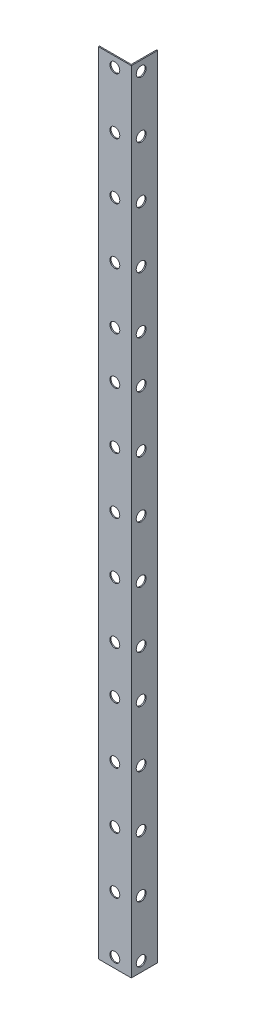
from build123d import *

# Parameters (mm, degrees)
BOSS_EXTRUDE1_DEPTH = 360
CUT_EXTRUDE1_REACH  = 362.492
SKETCH2_R           = 2.25
CUT_EXTRUDE2_REACH  = 362.512
SKETCH3_R           = 2.25


with BuildPart() as part:
    # Sketch1 → Boss-Extrude1 (new body)
    with BuildSketch(Plane(origin=(0, 0, 0), x_dir=(1, 0, 0), z_dir=(0, 1, 0))):
        Polygon((0, 0), (15, 0), (15, 12), (14.5, 12), (14.5, 0.5), (0, 0.5), align=None)
    extrude(amount=BOSS_EXTRUDE1_DEPTH)

    # Sketch2 → Cut-Extrude1 (cut, up to next)
    with BuildSketch(Plane.ZY.offset(-14.5), mode=Mode.PRIVATE) as cut_extrude1_sk1:
        with Locations((-4.5, 355.5)):
            Circle(SKETCH2_R)
    cut_extrude1_tool1 = extrude(cut_extrude1_sk1.sketch, amount=-CUT_EXTRUDE1_REACH, mode=Mode.PRIVATE) & part.part
    # Sketch2 → Cut-Extrude1 (cut, up to next)
    with BuildSketch(Plane.ZY.offset(-14.5), mode=Mode.PRIVATE) as cut_extrude1_sk2:
        with Locations((-4.5, 329.8125)):
            Circle(SKETCH2_R)
    cut_extrude1_tool2 = extrude(cut_extrude1_sk2.sketch, amount=-CUT_EXTRUDE1_REACH, mode=Mode.PRIVATE) & part.part
    # Sketch2 → Cut-Extrude1 (cut, up to next)
    with BuildSketch(Plane.ZY.offset(-14.5), mode=Mode.PRIVATE) as cut_extrude1_sk3:
        with Locations((-4.5, 304.125)):
            Circle(SKETCH2_R)
    cut_extrude1_tool3 = extrude(cut_extrude1_sk3.sketch, amount=-CUT_EXTRUDE1_REACH, mode=Mode.PRIVATE) & part.part
    # Sketch2 → Cut-Extrude1 (cut, up to next)
    with BuildSketch(Plane.ZY.offset(-14.5), mode=Mode.PRIVATE) as cut_extrude1_sk4:
        with Locations((-4.5, 278.4375)):
            Circle(SKETCH2_R)
    cut_extrude1_tool4 = extrude(cut_extrude1_sk4.sketch, amount=-CUT_EXTRUDE1_REACH, mode=Mode.PRIVATE) & part.part
    # Sketch2 → Cut-Extrude1 (cut, up to next)
    with BuildSketch(Plane.ZY.offset(-14.5), mode=Mode.PRIVATE) as cut_extrude1_sk5:
        with Locations((-4.5, 252.75)):
            Circle(SKETCH2_R)
    cut_extrude1_tool5 = extrude(cut_extrude1_sk5.sketch, amount=-CUT_EXTRUDE1_REACH, mode=Mode.PRIVATE) & part.part
    # Sketch2 → Cut-Extrude1 (cut, up to next)
    with BuildSketch(Plane.ZY.offset(-14.5), mode=Mode.PRIVATE) as cut_extrude1_sk6:
        with Locations((-4.5, 231.375)):
            Circle(SKETCH2_R)
    cut_extrude1_tool6 = extrude(cut_extrude1_sk6.sketch, amount=-CUT_EXTRUDE1_REACH, mode=Mode.PRIVATE) & part.part
    # Sketch2 → Cut-Extrude1 (cut, up to next)
    with BuildSketch(Plane.ZY.offset(-14.5), mode=Mode.PRIVATE) as cut_extrude1_sk7:
        with Locations((-4.5, 205.6875)):
            Circle(SKETCH2_R)
    cut_extrude1_tool7 = extrude(cut_extrude1_sk7.sketch, amount=-CUT_EXTRUDE1_REACH, mode=Mode.PRIVATE) & part.part
    # Sketch2 → Cut-Extrude1 (cut, up to next)
    with BuildSketch(Plane.ZY.offset(-14.5), mode=Mode.PRIVATE) as cut_extrude1_sk8:
        with Locations((-4.5, 180)):
            Circle(SKETCH2_R)
    cut_extrude1_tool8 = extrude(cut_extrude1_sk8.sketch, amount=-CUT_EXTRUDE1_REACH, mode=Mode.PRIVATE) & part.part
    # Sketch2 → Cut-Extrude1 (cut, up to next)
    with BuildSketch(Plane.ZY.offset(-14.5), mode=Mode.PRIVATE) as cut_extrude1_sk9:
        with Locations((-4.5, 154.3125)):
            Circle(SKETCH2_R)
    cut_extrude1_tool9 = extrude(cut_extrude1_sk9.sketch, amount=-CUT_EXTRUDE1_REACH, mode=Mode.PRIVATE) & part.part
    # Sketch2 → Cut-Extrude1 (cut, up to next)
    with BuildSketch(Plane.ZY.offset(-14.5), mode=Mode.PRIVATE) as cut_extrude1_sk10:
        with Locations((-4.5, 128.625)):
            Circle(SKETCH2_R)
    cut_extrude1_tool10 = extrude(cut_extrude1_sk10.sketch, amount=-CUT_EXTRUDE1_REACH, mode=Mode.PRIVATE) & part.part
    # Sketch2 → Cut-Extrude1 (cut, up to next)
    with BuildSketch(Plane.ZY.offset(-14.5), mode=Mode.PRIVATE) as cut_extrude1_sk11:
        with Locations((-4.5, 107.25)):
            Circle(SKETCH2_R)
    cut_extrude1_tool11 = extrude(cut_extrude1_sk11.sketch, amount=-CUT_EXTRUDE1_REACH, mode=Mode.PRIVATE) & part.part
    # Sketch2 → Cut-Extrude1 (cut, up to next)
    with BuildSketch(Plane.ZY.offset(-14.5), mode=Mode.PRIVATE) as cut_extrude1_sk12:
        with Locations((-4.5, 81.5625)):
            Circle(SKETCH2_R)
    cut_extrude1_tool12 = extrude(cut_extrude1_sk12.sketch, amount=-CUT_EXTRUDE1_REACH, mode=Mode.PRIVATE) & part.part
    # Sketch2 → Cut-Extrude1 (cut, up to next)
    with BuildSketch(Plane.ZY.offset(-14.5), mode=Mode.PRIVATE) as cut_extrude1_sk13:
        with Locations((-4.5, 55.875)):
            Circle(SKETCH2_R)
    cut_extrude1_tool13 = extrude(cut_extrude1_sk13.sketch, amount=-CUT_EXTRUDE1_REACH, mode=Mode.PRIVATE) & part.part
    # Sketch2 → Cut-Extrude1 (cut, up to next)
    with BuildSketch(Plane.ZY.offset(-14.5), mode=Mode.PRIVATE) as cut_extrude1_sk14:
        with Locations((-4.5, 30.1875)):
            Circle(SKETCH2_R)
    cut_extrude1_tool14 = extrude(cut_extrude1_sk14.sketch, amount=-CUT_EXTRUDE1_REACH, mode=Mode.PRIVATE) & part.part
    # Sketch2 → Cut-Extrude1 (cut, up to next)
    with BuildSketch(Plane.ZY.offset(-14.5), mode=Mode.PRIVATE) as cut_extrude1_sk15:
        with Locations((-4.5, 4.5)):
            Circle(SKETCH2_R)
    cut_extrude1_tool15 = extrude(cut_extrude1_sk15.sketch, amount=-CUT_EXTRUDE1_REACH, mode=Mode.PRIVATE) & part.part
    add(cut_extrude1_tool1.solids().sort_by_distance((14.5, 355.5, -4.5))[0], mode=Mode.SUBTRACT)
    add(cut_extrude1_tool2.solids().sort_by_distance((14.5, 329.8125, -4.5))[0], mode=Mode.SUBTRACT)
    add(cut_extrude1_tool3.solids().sort_by_distance((14.5, 304.125, -4.5))[0], mode=Mode.SUBTRACT)
    add(cut_extrude1_tool4.solids().sort_by_distance((14.5, 278.4375, -4.5))[0], mode=Mode.SUBTRACT)
    add(cut_extrude1_tool5.solids().sort_by_distance((14.5, 252.75, -4.5))[0], mode=Mode.SUBTRACT)
    add(cut_extrude1_tool6.solids().sort_by_distance((14.5, 231.375, -4.5))[0], mode=Mode.SUBTRACT)
    add(cut_extrude1_tool7.solids().sort_by_distance((14.5, 205.6875, -4.5))[0], mode=Mode.SUBTRACT)
    add(cut_extrude1_tool8.solids().sort_by_distance((14.5, 180, -4.5))[0], mode=Mode.SUBTRACT)
    add(cut_extrude1_tool9.solids().sort_by_distance((14.5, 154.3125, -4.5))[0], mode=Mode.SUBTRACT)
    add(cut_extrude1_tool10.solids().sort_by_distance((14.5, 128.625, -4.5))[0], mode=Mode.SUBTRACT)
    add(cut_extrude1_tool11.solids().sort_by_distance((14.5, 107.25, -4.5))[0], mode=Mode.SUBTRACT)
    add(cut_extrude1_tool12.solids().sort_by_distance((14.5, 81.5625, -4.5))[0], mode=Mode.SUBTRACT)
    add(cut_extrude1_tool13.solids().sort_by_distance((14.5, 55.875, -4.5))[0], mode=Mode.SUBTRACT)
    add(cut_extrude1_tool14.solids().sort_by_distance((14.5, 30.1875, -4.5))[0], mode=Mode.SUBTRACT)
    add(cut_extrude1_tool15.solids().sort_by_distance((14.5, 4.5, -4.5))[0], mode=Mode.SUBTRACT)

    # Sketch3 → Cut-Extrude2 (cut, up to next)
    with BuildSketch(Plane.XY, mode=Mode.PRIVATE) as cut_extrude2_sk1:
        with Locations((7.5, 355.5)):
            Circle(SKETCH3_R)
    cut_extrude2_tool1 = extrude(cut_extrude2_sk1.sketch, amount=-CUT_EXTRUDE2_REACH, mode=Mode.PRIVATE) & part.part
    # Sketch3 → Cut-Extrude2 (cut, up to next)
    with BuildSketch(Plane.XY, mode=Mode.PRIVATE) as cut_extrude2_sk2:
        with Locations((7.5, 329.84375)):
            Circle(SKETCH3_R)
    cut_extrude2_tool2 = extrude(cut_extrude2_sk2.sketch, amount=-CUT_EXTRUDE2_REACH, mode=Mode.PRIVATE) & part.part
    # Sketch3 → Cut-Extrude2 (cut, up to next)
    with BuildSketch(Plane.XY, mode=Mode.PRIVATE) as cut_extrude2_sk3:
        with Locations((7.5, 304.1875)):
            Circle(SKETCH3_R)
    cut_extrude2_tool3 = extrude(cut_extrude2_sk3.sketch, amount=-CUT_EXTRUDE2_REACH, mode=Mode.PRIVATE) & part.part
    # Sketch3 → Cut-Extrude2 (cut, up to next)
    with BuildSketch(Plane.XY, mode=Mode.PRIVATE) as cut_extrude2_sk4:
        with Locations((7.5, 278.53125)):
            Circle(SKETCH3_R)
    cut_extrude2_tool4 = extrude(cut_extrude2_sk4.sketch, amount=-CUT_EXTRUDE2_REACH, mode=Mode.PRIVATE) & part.part
    # Sketch3 → Cut-Extrude2 (cut, up to next)
    with BuildSketch(Plane.XY, mode=Mode.PRIVATE) as cut_extrude2_sk5:
        with Locations((7.5, 252.875)):
            Circle(SKETCH3_R)
    cut_extrude2_tool5 = extrude(cut_extrude2_sk5.sketch, amount=-CUT_EXTRUDE2_REACH, mode=Mode.PRIVATE) & part.part
    # Sketch3 → Cut-Extrude2 (cut, up to next)
    with BuildSketch(Plane.XY, mode=Mode.PRIVATE) as cut_extrude2_sk6:
        with Locations((7.5, 231.3125)):
            Circle(SKETCH3_R)
    cut_extrude2_tool6 = extrude(cut_extrude2_sk6.sketch, amount=-CUT_EXTRUDE2_REACH, mode=Mode.PRIVATE) & part.part
    # Sketch3 → Cut-Extrude2 (cut, up to next)
    with BuildSketch(Plane.XY, mode=Mode.PRIVATE) as cut_extrude2_sk7:
        with Locations((7.5, 205.65625)):
            Circle(SKETCH3_R)
    cut_extrude2_tool7 = extrude(cut_extrude2_sk7.sketch, amount=-CUT_EXTRUDE2_REACH, mode=Mode.PRIVATE) & part.part
    # Sketch3 → Cut-Extrude2 (cut, up to next)
    with BuildSketch(Plane.XY, mode=Mode.PRIVATE) as cut_extrude2_sk8:
        with Locations((7.5, 180)):
            Circle(SKETCH3_R)
    cut_extrude2_tool8 = extrude(cut_extrude2_sk8.sketch, amount=-CUT_EXTRUDE2_REACH, mode=Mode.PRIVATE) & part.part
    # Sketch3 → Cut-Extrude2 (cut, up to next)
    with BuildSketch(Plane.XY, mode=Mode.PRIVATE) as cut_extrude2_sk9:
        with Locations((7.5, 154.34375)):
            Circle(SKETCH3_R)
    cut_extrude2_tool9 = extrude(cut_extrude2_sk9.sketch, amount=-CUT_EXTRUDE2_REACH, mode=Mode.PRIVATE) & part.part
    # Sketch3 → Cut-Extrude2 (cut, up to next)
    with BuildSketch(Plane.XY, mode=Mode.PRIVATE) as cut_extrude2_sk10:
        with Locations((7.5, 128.6875)):
            Circle(SKETCH3_R)
    cut_extrude2_tool10 = extrude(cut_extrude2_sk10.sketch, amount=-CUT_EXTRUDE2_REACH, mode=Mode.PRIVATE) & part.part
    # Sketch3 → Cut-Extrude2 (cut, up to next)
    with BuildSketch(Plane.XY, mode=Mode.PRIVATE) as cut_extrude2_sk11:
        with Locations((7.5, 107.125)):
            Circle(SKETCH3_R)
    cut_extrude2_tool11 = extrude(cut_extrude2_sk11.sketch, amount=-CUT_EXTRUDE2_REACH, mode=Mode.PRIVATE) & part.part
    # Sketch3 → Cut-Extrude2 (cut, up to next)
    with BuildSketch(Plane.XY, mode=Mode.PRIVATE) as cut_extrude2_sk12:
        with Locations((7.5, 81.46875)):
            Circle(SKETCH3_R)
    cut_extrude2_tool12 = extrude(cut_extrude2_sk12.sketch, amount=-CUT_EXTRUDE2_REACH, mode=Mode.PRIVATE) & part.part
    # Sketch3 → Cut-Extrude2 (cut, up to next)
    with BuildSketch(Plane.XY, mode=Mode.PRIVATE) as cut_extrude2_sk13:
        with Locations((7.5, 55.8125)):
            Circle(SKETCH3_R)
    cut_extrude2_tool13 = extrude(cut_extrude2_sk13.sketch, amount=-CUT_EXTRUDE2_REACH, mode=Mode.PRIVATE) & part.part
    # Sketch3 → Cut-Extrude2 (cut, up to next)
    with BuildSketch(Plane.XY, mode=Mode.PRIVATE) as cut_extrude2_sk14:
        with Locations((7.5, 30.15625)):
            Circle(SKETCH3_R)
    cut_extrude2_tool14 = extrude(cut_extrude2_sk14.sketch, amount=-CUT_EXTRUDE2_REACH, mode=Mode.PRIVATE) & part.part
    # Sketch3 → Cut-Extrude2 (cut, up to next)
    with BuildSketch(Plane.XY, mode=Mode.PRIVATE) as cut_extrude2_sk15:
        with Locations((7.5, 4.5)):
            Circle(SKETCH3_R)
    cut_extrude2_tool15 = extrude(cut_extrude2_sk15.sketch, amount=-CUT_EXTRUDE2_REACH, mode=Mode.PRIVATE) & part.part
    add(cut_extrude2_tool1.solids().sort_by_distance((7.5, 355.5, 0))[0], mode=Mode.SUBTRACT)
    add(cut_extrude2_tool2.solids().sort_by_distance((7.5, 329.84375, 0))[0], mode=Mode.SUBTRACT)
    add(cut_extrude2_tool3.solids().sort_by_distance((7.5, 304.1875, 0))[0], mode=Mode.SUBTRACT)
    add(cut_extrude2_tool4.solids().sort_by_distance((7.5, 278.53125, 0))[0], mode=Mode.SUBTRACT)
    add(cut_extrude2_tool5.solids().sort_by_distance((7.5, 252.875, 0))[0], mode=Mode.SUBTRACT)
    add(cut_extrude2_tool6.solids().sort_by_distance((7.5, 231.3125, 0))[0], mode=Mode.SUBTRACT)
    add(cut_extrude2_tool7.solids().sort_by_distance((7.5, 205.65625, 0))[0], mode=Mode.SUBTRACT)
    add(cut_extrude2_tool8.solids().sort_by_distance((7.5, 180, 0))[0], mode=Mode.SUBTRACT)
    add(cut_extrude2_tool9.solids().sort_by_distance((7.5, 154.34375, 0))[0], mode=Mode.SUBTRACT)
    add(cut_extrude2_tool10.solids().sort_by_distance((7.5, 128.6875, 0))[0], mode=Mode.SUBTRACT)
    add(cut_extrude2_tool11.solids().sort_by_distance((7.5, 107.125, 0))[0], mode=Mode.SUBTRACT)
    add(cut_extrude2_tool12.solids().sort_by_distance((7.5, 81.46875, 0))[0], mode=Mode.SUBTRACT)
    add(cut_extrude2_tool13.solids().sort_by_distance((7.5, 55.8125, 0))[0], mode=Mode.SUBTRACT)
    add(cut_extrude2_tool14.solids().sort_by_distance((7.5, 30.15625, 0))[0], mode=Mode.SUBTRACT)
    add(cut_extrude2_tool15.solids().sort_by_distance((7.5, 4.5, 0))[0], mode=Mode.SUBTRACT)


solid = part.part
